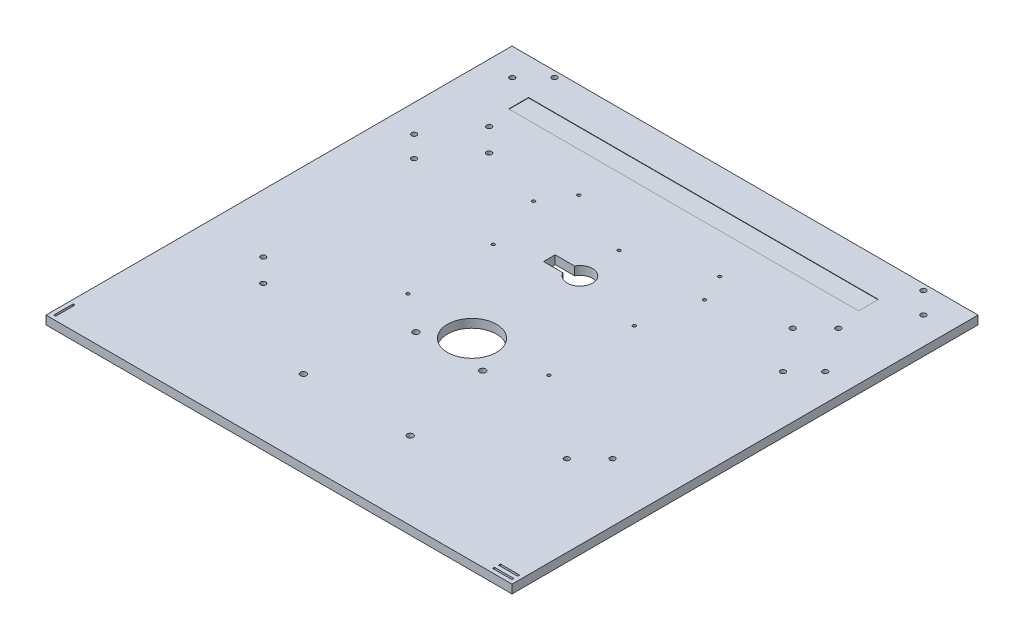
from build123d import *

# Parameters (mm, degrees)
SKETCH2_W           = 304.8
SKETCH2_H           = 304.8
BOSS_EXTRUDE1_DEPTH = 5.588
SKETCH4_W           = 1.27
SKETCH4_H           = 12.7
SKETCH4_W_2         = 12.7
SKETCH4_H_2         = 1.27
CUT_EXTRUDE1_DEPTH  = 432.088512656
SKETCH5_W           = 228.854
SKETCH5_H           = 12.954
CUT_EXTRUDE2_DEPTH  = 0.254
SKETCH6_R           = 16.002
SKETCH6_R_2         = 1.7
SKETCH6_R_3         = 1.96
CUT_EXTRUDE3_DEPTH  = 432.088512656
CUT_EXTRUDE4_DEPTH  = 432.088512656
SKETCH8_R           = 1.016
CUT_EXTRUDE5_DEPTH  = 432.088512656
SKETCH9_R           = 1.016
CUT_EXTRUDE6_DEPTH  = 432.088512656


with BuildPart() as part:
    # Sketch2 → Boss-Extrude1 (new body)
    with BuildSketch(Plane(origin=(0, 0, 0), x_dir=(1, 0, 0), z_dir=(0, 1, 0))):
        with Locations((152.4, 152.4)):
            Rectangle(SKETCH2_W, SKETCH2_H)
    extrude(amount=BOSS_EXTRUDE1_DEPTH)

    # Sketch4 → Cut-Extrude1 (cut, through all)
    with BuildSketch(Plane(origin=(0, 5.588, 0), x_dir=(1, 0, 0), z_dir=(0, 1, 0))):
        with Locations((3.175, 8.89)):
            Rectangle(SKETCH4_W, SKETCH4_H)
        with Locations((295.91, 3.175)):
            Rectangle(SKETCH4_W_2, SKETCH4_H_2)
        with Locations((295.91, 6.985)):
            Rectangle(SKETCH4_W_2, SKETCH4_H_2)
    extrude(amount=-CUT_EXTRUDE1_DEPTH, mode=Mode.SUBTRACT)

    # Sketch5 → Cut-Extrude2 (cut)
    with BuildSketch(Plane(origin=(0, 5.588, 0), x_dir=(1, 0, 0), z_dir=(0, 1, 0))):
        with Locations((148.97354, 274.58924)):
            Rectangle(SKETCH5_W, SKETCH5_H)
    extrude(amount=-CUT_EXTRUDE2_DEPTH, mode=Mode.SUBTRACT)

    # Sketch6 → Cut-Extrude3 (cut, through all)
    with BuildSketch(Plane(origin=(0, 5.588, 0), x_dir=(1, 0, 0), z_dir=(0, 1, 0))):
        with Locations((152.4799846, 126.1262654)):
            Circle(SKETCH6_R)
        with Locations((31.75, 300.832130008)):
            Circle(SKETCH6_R_2)
        with Locations((17.93875, 287.020880008)):
            Circle(SKETCH6_R_2)
        with Locations((273.05, 300.832130008)):
            Circle(SKETCH6_R_2)
        with Locations((286.86125, 287.020880008)):
            Circle(SKETCH6_R_2)
        with Locations((286.86125, 222.781740008)):
            Circle(SKETCH6_R_2)
        with Locations((273.05, 208.970490008)):
            Circle(SKETCH6_R_2)
        with Locations((31.75, 208.970490008)):
            Circle(SKETCH6_R_2)
        with Locations((17.93875, 222.781740008)):
            Circle(SKETCH6_R_2)
        with Locations((38.1787654, 103.9330154)):
            Circle(SKETCH6_R_2)
        with Locations((53.1330154, 88.9787654)):
            Circle(SKETCH6_R_2)
        with Locations((251.6669846, 88.9787654)):
            Circle(SKETCH6_R_2)
        with Locations((266.6212346, 103.9330154)):
            Circle(SKETCH6_R_2)
        with Locations((266.6212346, 251.6669846)):
            Circle(SKETCH6_R_2)
        with Locations((251.6669846, 236.7127346)):
            Circle(SKETCH6_R_2)
        with Locations((53.1330154, 236.7127346)):
            Circle(SKETCH6_R_2)
        with Locations((38.1787654, 251.6669846)):
            Circle(SKETCH6_R_2)
        with Locations((130.6518596, 111.328047494)):
            Circle(SKETCH6_R_3)
        with Locations((174.3081096, 111.328047494)):
            Circle(SKETCH6_R_3)
        with Locations((187.4049846, 50.821596477)):
            Circle(SKETCH6_R_3)
        with Locations((117.5549846, 50.821596477)):
            Circle(SKETCH6_R_3)
    extrude(amount=-CUT_EXTRUDE3_DEPTH, mode=Mode.SUBTRACT)

    # Sketch7 → Cut-Extrude4 (cut, through all)
    with BuildSketch(Plane(origin=(0, 5.588, 0), x_dir=(1, 0, 0), z_dir=(0, 1, 0))):
        with BuildLine():
            Line((145.076822752, 200.66), (132.376822752, 200.66))
            Line((132.376822752, 200.66), (132.376822752, 193.04))
            Line((132.376822752, 193.04), (145.076822752, 193.04))
            ThreePointArc((145.076822752, 193.04), (160.655, 196.85), (145.076822752, 200.66))
        make_face()
    extrude(amount=-CUT_EXTRUDE4_DEPTH, mode=Mode.SUBTRACT)

    # Sketch8 → Cut-Extrude5 (cut, through all)
    with BuildSketch(Plane(origin=(0, 5.588, 0), x_dir=(1, 0, 0), z_dir=(0, 1, 0))):
        with Locations((206.6999846, 223.9950154)):
            Circle(SKETCH8_R)
        with Locations((150.8199846, 223.9950154)):
            Circle(SKETCH8_R)
        with Locations((94.9399846, 223.9950154)):
            Circle(SKETCH8_R)
    extrude(amount=-CUT_EXTRUDE5_DEPTH, mode=Mode.SUBTRACT)

    # Sketch9 → Cut-Extrude6 (cut, through all)
    with BuildSketch(Plane(origin=(0, 5.588, 0), x_dir=(1, 0, 0), z_dir=(0, 1, 0))):
        with Locations((106.3, 242.18)):
            Circle(SKETCH9_R)
        with Locations((106.3, 186.3)):
            Circle(SKETCH9_R)
        with Locations((106.3, 130.42)):
            Circle(SKETCH9_R)
        with Locations((198.5, 130.42)):
            Circle(SKETCH9_R)
        with Locations((198.5, 186.3)):
            Circle(SKETCH9_R)
        with Locations((198.5, 242.18)):
            Circle(SKETCH9_R)
    extrude(amount=-CUT_EXTRUDE6_DEPTH, mode=Mode.SUBTRACT)


solid = part.part
